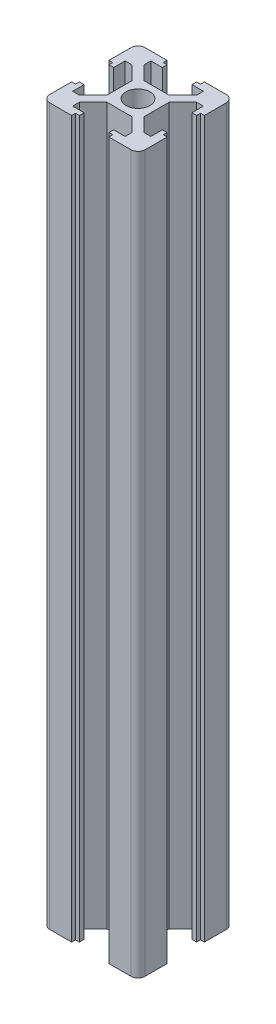
from build123d import *

# Parameters (mm, degrees)
BOSS_EXTRUDE1_DEPTH = 150


with BuildPart() as part:
    # Sketch1 → Boss-Extrude1 (new body)
    with BuildSketch(Plane(origin=(0, 0, 0), x_dir=(1, 0, 0), z_dir=(0, 1, 0))):
        with BuildLine():
            Line((8.5, 10), (3.9, 10))
            Line((3.9, 10), (3.9, 9.2))
            Line((3.9, 9.2), (3.1, 9.2))
            Line((3.1, 9.2), (3.1, 8.2))
            Line((3.1, 8.2), (5.5, 8.2))
            Line((5.5, 8.2), (5.5, 6.77))
            Line((5.5, 6.77), (2.63, 3.9))
            Line((2.63, 3.9), (2.549104946, 3.9))
            Line((2.549104946, 3.9), (0, 3.9))
            Line((0, 3.9), (-2.63, 3.9))
            Line((-2.63, 3.9), (-5.5, 6.77))
            Line((-5.5, 6.77), (-5.5, 8.2))
            Line((-5.5, 8.2), (-3.1, 8.2))
            Line((-3.1, 8.2), (-3.1, 9.2))
            Line((-3.1, 9.2), (-3.9, 9.2))
            Line((-3.9, 9.2), (-3.9, 10))
            Line((-3.9, 10), (-8.5, 10))
            ThreePointArc((-8.5, 10), (-9.560660172, 9.560660172), (-10, 8.5))
            Line((-10, 8.5), (-10, 3.9))
            Line((-10, 3.9), (-9.2, 3.9))
            Line((-9.2, 3.9), (-9.2, 3.1))
            Line((-9.2, 3.1), (-8.2, 3.1))
            Line((-8.2, 3.1), (-8.2, 5.5))
            Line((-8.2, 5.5), (-6.77, 5.5))
            Line((-6.77, 5.5), (-3.9, 2.63))
            Line((-3.9, 2.63), (-3.9, 0))
            Line((-3.9, 0), (-3.9, -2.63))
            Line((-3.9, -2.63), (-6.77, -5.5))
            Line((-6.77, -5.5), (-8.2, -5.5))
            Line((-8.2, -5.5), (-8.2, -3.1))
            Line((-8.2, -3.1), (-9.2, -3.1))
            Line((-9.2, -3.1), (-9.2, -3.9))
            Line((-9.2, -3.9), (-10, -3.9))
            Line((-10, -3.9), (-10, -8.5))
            ThreePointArc((-10, -8.5), (-9.560660172, -9.560660172), (-8.5, -10))
            Line((-8.5, -10), (-3.9, -10))
            Line((-3.9, -10), (-3.9, -9.2))
            Line((-3.9, -9.2), (-3.1, -9.2))
            Line((-3.1, -9.2), (-3.1, -8.2))
            Line((-3.1, -8.2), (-5.5, -8.2))
            Line((-5.5, -8.2), (-5.5, -6.77))
            Line((-5.5, -6.77), (-2.63, -3.9))
            Line((-2.63, -3.9), (0, -3.9))
            Line((0, -3.9), (2.63, -3.9))
            Line((2.63, -3.9), (5.5, -6.77))
            Line((5.5, -6.77), (5.5, -8.2))
            Line((5.5, -8.2), (3.1, -8.2))
            Line((3.1, -8.2), (3.1, -9.2))
            Line((3.1, -9.2), (3.9, -9.2))
            Line((3.9, -9.2), (3.9, -10))
            Line((3.9, -10), (8.5, -10))
            ThreePointArc((8.5, -10), (9.560660172, -9.560660172), (10, -8.5))
            Line((10, -8.5), (10, -3.9))
            Line((10, -3.9), (9.2, -3.9))
            Line((9.2, -3.9), (9.2, -3.1))
            Line((9.2, -3.1), (8.2, -3.1))
            Line((8.2, -3.1), (8.2, -5.5))
            Line((8.2, -5.5), (6.77, -5.5))
            Line((6.77, -5.5), (3.9, -2.63))
            Line((3.9, -2.63), (3.9, 0))
            Line((3.9, 0), (3.9, 2.63))
            Line((3.9, 2.63), (6.77, 5.5))
            Line((6.77, 5.5), (8.2, 5.5))
            Line((8.2, 5.5), (8.2, 3.1))
            Line((8.2, 3.1), (9.2, 3.1))
            Line((9.2, 3.1), (9.2, 3.9))
            Line((9.2, 3.9), (10, 3.9))
            Line((10, 3.9), (10, 8.5))
            ThreePointArc((10, 8.5), (9.560660172, 9.560660172), (8.5, 10))
        make_face()
        with BuildLine():
            ThreePointArc((0, 2.5), (1.767766953, 1.767766953), (2.5, 0))
            ThreePointArc((2.5, 0), (-1.767766953, -1.767766953), (0, 2.5))
        make_face(mode=Mode.SUBTRACT)
    extrude(amount=BOSS_EXTRUDE1_DEPTH)


solid = part.part
